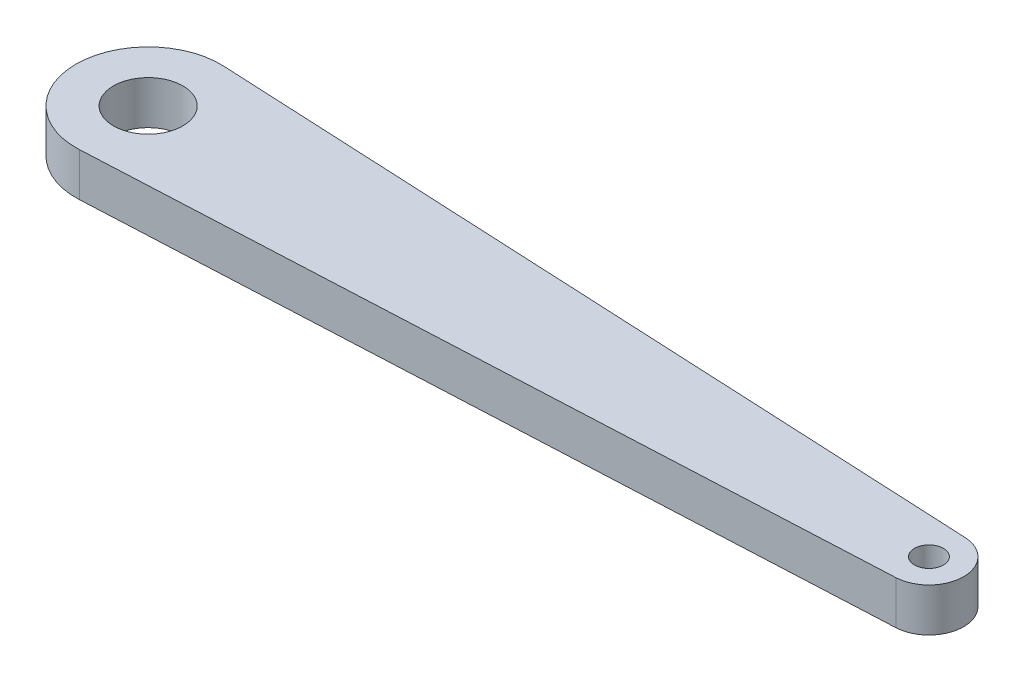
from build123d import *

# Parameters (mm, degrees)
SKETCH2_R           = 2.5
SKETCH2_R_2         = 6
BOSS_EXTRUDE1_DEPTH = 7.5


with BuildPart() as part:
    # Sketch2 → Boss-Extrude1 (new body)
    with BuildSketch(Plane(origin=(0, 0, 0), x_dir=(1, 0, 0), z_dir=(0, 1, 0))):
        with BuildLine():
            Line((-23.308725701, 12.485502567), (111.378311336, 5.993041232))
            ThreePointArc((111.378311336, 5.993041232), (117.089422447, 0), (111.378311336, -5.993041232))
            Line((111.378311336, -5.993041232), (-23.308725701, -12.485502567))
            ThreePointArc((-23.308725701, -12.485502567), (-36.410577553, 0), (-23.308725701, 12.485502567))
        make_face()
        with Locations((111.089422447, 0)):
            Circle(SKETCH2_R, mode=Mode.SUBTRACT)
        with Locations((-23.910577553, 0)):
            Circle(SKETCH2_R_2, mode=Mode.SUBTRACT)
    extrude(amount=BOSS_EXTRUDE1_DEPTH)


solid = part.part
